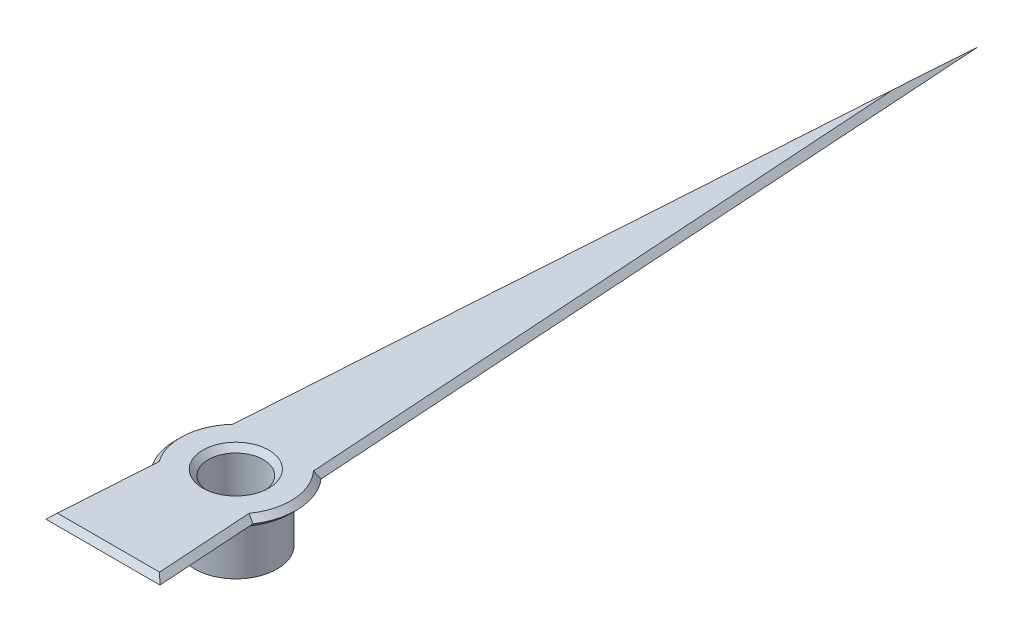
from build123d import *

# Parameters (mm, degrees)
SKETCH2_R           = 0.75
BOSS_EXTRUDE1_DEPTH = 1
SKETCH3_R           = 1.1
BOSS_EXTRUDE2_DEPTH = 0.2
BOSS_EXTRUDE3_DEPTH = 0.2
SKETCH5_R           = 0.5
CUT_EXTRUDE1_DEPTH  = 1
CHAMFER1_SIZE       = 0.1


with BuildPart() as part:
    # Sketch2 → Boss-Extrude1 (new body)
    with BuildSketch(Plane(origin=(0, 0, 0), x_dir=(1, 0, 0), z_dir=(0, 1, 0))):
        with Locations(Location((0, 0, 0), (0, 0, 270))):
            Circle(SKETCH2_R)
    extrude(amount=-BOSS_EXTRUDE1_DEPTH)

    # Sketch3 → Boss-Extrude2 (add)
    with BuildSketch(Plane(origin=(0, 0, 0), x_dir=(1, 0, 0), z_dir=(0, 1, 0))):
        with Locations(Location((0, 0, 0), (0, 0, 270))):
            Circle(SKETCH3_R)
    extrude(amount=BOSS_EXTRUDE2_DEPTH)

    # Sketch4 → Boss-Extrude3 (add)
    with BuildSketch(Plane(origin=(0, 0.2, 0), x_dir=(1, 0, 0), z_dir=(0, 1, 0))):
        Polygon((0, 13.5), (-1.036300873, -2.416623366), (1.036300873, -2.416623366), align=None)
    extrude(amount=-BOSS_EXTRUDE3_DEPTH)

    # Sketch5 → Cut-Extrude1 (cut)
    with BuildSketch(Plane(origin=(0, 0.2, 0), x_dir=(1, 0, 0), z_dir=(0, 1, 0))):
        with Locations(Location((0, 0, 0), (0, 0, 270))):
            Circle(SKETCH5_R)
    extrude(amount=-CUT_EXTRUDE1_DEPTH, mode=Mode.SUBTRACT)

    # Chamfer1
    chamfer1_edges = [part.edges().sort_by_distance(p)[0] for p in [
        (0.416059237, 0, -7.109714764),
    ]]
    chamfer(chamfer1_edges, length=CHAMFER1_SIZE)
    chamfer1_2_edges = [part.edges().sort_by_distance(p)[0] for p in [
        (-0.441112169, 0, -6.724924886),
    ]]
    chamfer(chamfer1_2_edges, length=CHAMFER1_SIZE)
    chamfer1_3_edges = [part.edges().sort_by_distance(p)[0] for p in [
        (0.416059237, 0.2, -7.109714764),
    ]]
    chamfer(chamfer1_3_edges, length=CHAMFER1_SIZE - 0.0001)  # a hair under: the kernel refuses the full size
    chamfer1_4_edges = [part.edges().sort_by_distance(p)[0] for p in [
        (-0.441087116, 0.2, -6.725309676),
    ]]
    chamfer(chamfer1_4_edges, length=CHAMFER1_SIZE - 0.0001)  # a hair under: the kernel refuses the full size
    chamfer1_5_edges = [part.edges().sort_by_distance(p)[0] for p in [
        (0, 0, -0.75),
    ]]
    chamfer(chamfer1_5_edges, length=CHAMFER1_SIZE)
    chamfer1_6_edges = [part.edges().sort_by_distance(p)[0] for p in [
        (0, 0.2, -0.5),
    ]]
    chamfer(chamfer1_6_edges, length=CHAMFER1_SIZE)
    chamfer1_7_edges = [part.edges().sort_by_distance(p)[0] for p in [
        (0, 0, 2.416623366),
    ]]
    chamfer(chamfer1_7_edges, length=CHAMFER1_SIZE)
    chamfer1_8_edges = [part.edges().sort_by_distance(p)[0] for p in [
        (0, 0.2, 2.416623366),
    ]]
    chamfer(chamfer1_8_edges, length=CHAMFER1_SIZE - 0.0001)  # a hair under: the kernel refuses the full size
    chamfer1_9_edges = [part.edges().sort_by_distance(p)[0] for p in [
        (0.974084713, 0, 1.461040666),
    ]]
    chamfer(chamfer1_9_edges, length=CHAMFER1_SIZE)
    chamfer1_10_edges = [part.edges().sort_by_distance(p)[0] for p in [
        (0.974087969, 0.2, 1.461090666),
    ]]
    chamfer(chamfer1_10_edges, length=CHAMFER1_SIZE - 0.0001)  # a hair under: the kernel refuses the full size
    chamfer1_11_edges = [part.edges().sort_by_distance(p)[0] for p in [
        (-0.974084713, 0, 1.461040666),
    ]]
    chamfer(chamfer1_11_edges, length=CHAMFER1_SIZE)
    chamfer1_12_edges = [part.edges().sort_by_distance(p)[0] for p in [
        (-0.974087969, 0.2, 1.461090666),
    ]]
    chamfer(chamfer1_12_edges, length=CHAMFER1_SIZE - 0.0001)  # a hair under: the kernel refuses the full size
    chamfer1_13_edges = [part.edges().sort_by_distance(p)[0] for p in [
        (1.097675902, 0, -0.071467576),
    ]]
    chamfer(chamfer1_13_edges, length=CHAMFER1_SIZE)
    chamfer1_14_edges = [part.edges().sort_by_distance(p)[0] for p in [
        (1.097675902, 0.2, -0.071467576),
    ]]
    chamfer(chamfer1_14_edges, length=CHAMFER1_SIZE - 0.0001)  # a hair under: the kernel refuses the full size
    chamfer1_15_edges = [part.edges().sort_by_distance(p)[0] for p in [
        (-1.097675902, 0, -0.071467576),
    ]]
    chamfer(chamfer1_15_edges, length=CHAMFER1_SIZE - 0.0001)  # a hair under: the kernel refuses the full size
    chamfer1_16_edges = [part.edges().sort_by_distance(p)[0] for p in [
        (-1.097675902, 0.2, -0.071467576),
    ]]
    chamfer(chamfer1_16_edges, length=CHAMFER1_SIZE - 0.0004)  # a hair under: the kernel refuses the full size


solid = part.part
